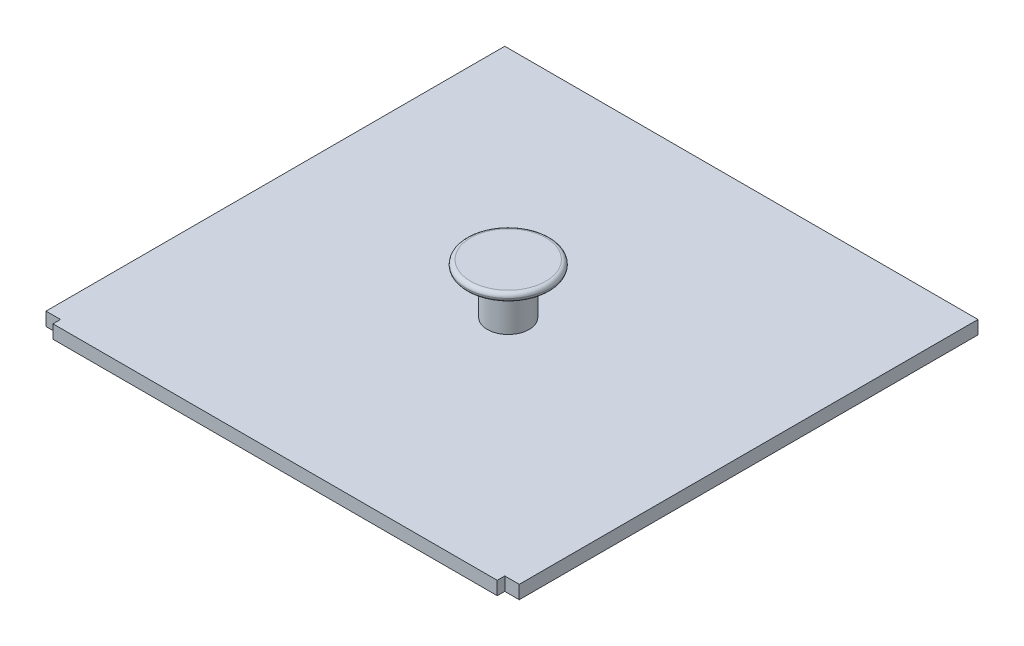
from build123d import *

# Parameters (mm, degrees)
SKETCH1_W           = 169.8
SKETCH1_H           = 167.3
BOSS_EXTRUDE1_DEPTH = 2.4
SKETCH2_R           = 7.5
BOSS_EXTRUDE2_DEPTH = 15
SKETCH6_R           = 15
BOSS_EXTRUDE4_DEPTH = 3
SKETCH7_W           = 5.2
SKETCH7_H           = 2.7
CUT_EXTRUDE1_DEPTH  = 121.537680831
FILLET2_R           = 1.5


with BuildPart() as part:
    # Sketch1 → Boss-Extrude1 (new, symmetric)
    with BuildSketch(Plane(origin=(0, 0, 0), x_dir=(1, 0, 0), z_dir=(0, 1, 0))):
        Rectangle(SKETCH1_W, SKETCH1_H)
    extrude(amount=BOSS_EXTRUDE1_DEPTH, both=True)

    # Sketch2 → Boss-Extrude2 (add)
    with BuildSketch(Plane(origin=(0, 2.4, 0), x_dir=(1, 0, 0), z_dir=(0, 1, 0))):
        with Locations(Location((0, 0, 0), (0, 0, 270))):
            Circle(SKETCH2_R)
    extrude(amount=BOSS_EXTRUDE2_DEPTH)

    # Sketch6 → Boss-Extrude4 (add)
    with BuildSketch(Plane(origin=(0, 17.4, 0), x_dir=(1, 0, 0), z_dir=(0, 1, 0))):
        with Locations(Location((0, 0, 0), (0, 0, 270))):
            Circle(SKETCH6_R)
    extrude(amount=BOSS_EXTRUDE4_DEPTH)

    # Sketch7 → Cut-Extrude1 (cut, through all)
    with BuildSketch(Plane(origin=(0, 2.4, 0), x_dir=(1, 0, 0), z_dir=(0, 1, 0))):
        with Locations((-82.3, -82.3)):
            Rectangle(SKETCH7_W, SKETCH7_H)
        with Locations((82.3, -82.3)):
            Rectangle(SKETCH7_W, SKETCH7_H)
    extrude(amount=-CUT_EXTRUDE1_DEPTH, mode=Mode.SUBTRACT)

    # Fillet2
    fillet2_edges = [part.edges().sort_by_distance(p)[0] for p in [
        (0, 17.4, -15),
        (0, 20.4, -15),
    ]]
    fillet(fillet2_edges, radius=FILLET2_R - 0.0001)  # a hair under: the kernel refuses the full size


solid = part.part
